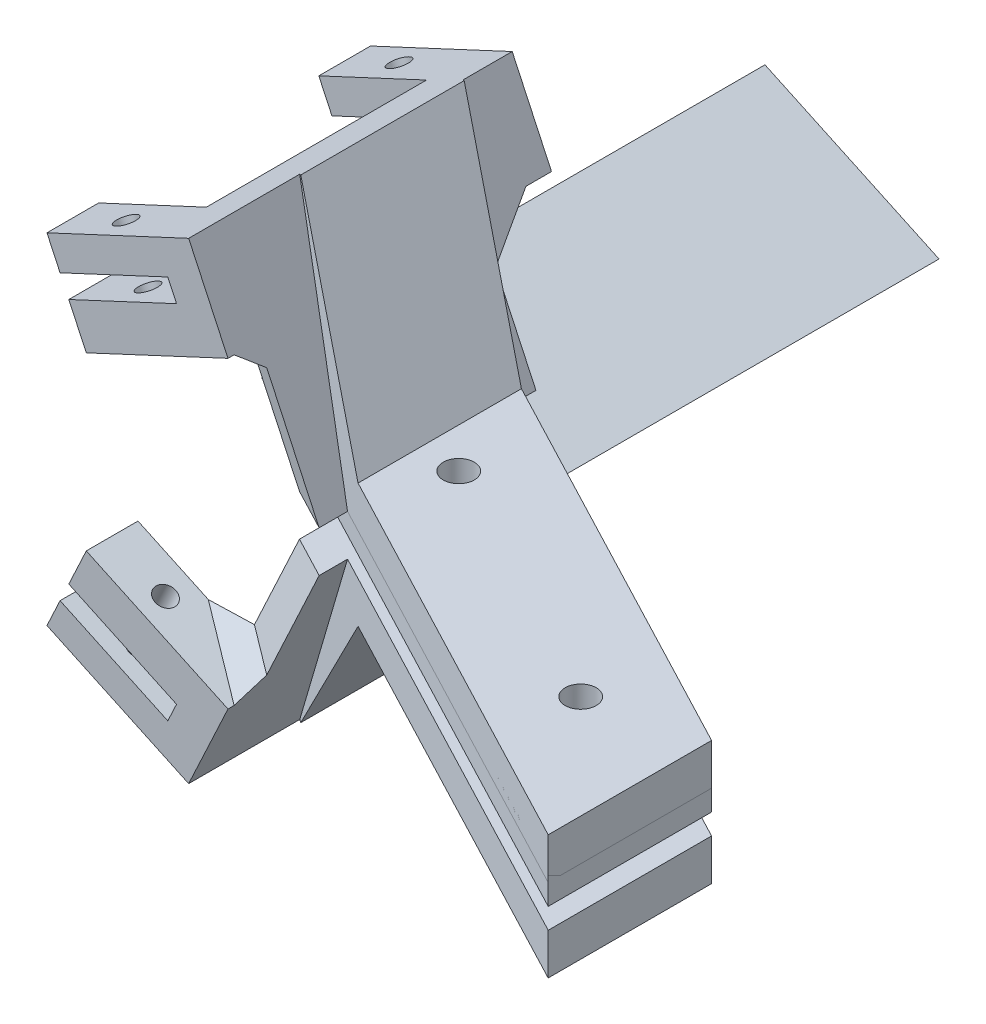
from build123d import *

# Parameters (mm, degrees)
BOSS_EXTRUDE1_DEPTH             = 3
SKETCH1_R                       = 6
BOSS_EXTRUDE3_DEPTH             = 2
SKETCH4_R                       = 1.5
CUT_EXTRUDE1_DEPTH              = 44.812962497
SKETCH5_R                       = 3.25
CUT_EXTRUDE2_DEPTH              = 2
SKETCH6_R                       = 1.5
BOSS_EXTRUDE4_DEPTH             = 4
CUT_EXTRUDE3_DEPTH              = 48.222467532
CUT_EXTRUDE3_DEPTH_BACK         = 48.222467532
SKETCH9_W                       = 15.125231148
SKETCH9_H                       = 5
SKETCH9_R                       = 1
BOSS_EXTRUDE6_DEPTH             = 4
SKETCH10_W                      = 3.625231148
SKETCH10_H                      = 31.3
BOSS_EXTRUDE7_DEPTH             = 2
SKETCH11_R                      = 1
BOSS_EXTRUDE8_DEPTH             = 3
CHAMFER2_SIZE                   = 4
CHAMFER3_SIZE                   = 2
CHAMFER4_SIZE                   = 4
CHAMFER4_SIZE_2                 = 20
BOSS_EXTRUDE9_DEPTH             = 47
BOSS_EXTRUDE9_DIRECTION_2_REACH = 51.204
SKETCH19_R                      = 3.25
CUT_EXTRUDE4_DEPTH              = 64.192904103
SKETCH20_R                      = 1.5
CUT_EXTRUDE5_DEPTH              = 64.192904103


with BuildPart() as part:
    # Sketch3 → Boss-Extrude1 (new body)
    with BuildSketch(Plane(origin=(0, 0, 0), x_dir=(1, 0, 0), z_dir=(0, 1, 0))):
        Polygon((-10, 13.145588768), (-10, -2.661376867), (34.799193535, -26.145588768), (34.799193535, -10.338623133), align=None)
    extrude(amount=BOSS_EXTRUDE1_DEPTH)

    # Sketch1 → Boss-Extrude3 (add)
    with BuildSketch(Plane(origin=(0, 0, 0), x_dir=(1, 0, 0), z_dir=(0, 1, 0))):
        with Locations(Location((0, 0, 0), (0, 0, 270))):
            Circle(SKETCH1_R)
        with Locations(Location((24.799193535, -13, 0), (0, 0, 270))):
            Circle(SKETCH1_R)
    extrude(amount=-BOSS_EXTRUDE3_DEPTH)

    # Sketch4 → Cut-Extrude1 (cut, through all)
    with BuildSketch(Plane(origin=(0, 3, 0), x_dir=(1, 0, 0), z_dir=(0, 1, 0))):
        with Locations(Location((0, 0, 0), (0, 0, 270))):
            Circle(SKETCH4_R)
        with Locations(Location((24.799193535, -13, 0), (0, 0, 270))):
            Circle(SKETCH4_R)
    extrude(amount=-CUT_EXTRUDE1_DEPTH, mode=Mode.SUBTRACT)

    # Sketch5 → Cut-Extrude2 (cut)
    with BuildSketch(Plane(origin=(0, 3, 0), x_dir=(1, 0, 0), z_dir=(0, 1, 0))):
        with Locations(Location((0, 0, 0), (0, 0, 270))):
            Circle(SKETCH5_R)
        with Locations(Location((24.799193535, -13, 0), (0, 0, 270))):
            Circle(SKETCH5_R)
    extrude(amount=-CUT_EXTRUDE2_DEPTH, mode=Mode.SUBTRACT)

    # Sketch18 → Boss-Extrude9 (add)
    with BuildSketch(Plane.XY):
        Polygon((-10, 0), (-19.06307787, 4.226182617), (-17.372604823, 7.851413766), (-0.535193667, 0), align=None)
    extrude(amount=-BOSS_EXTRUDE9_DEPTH)

    # Boss-Extrude9 direction 2: up to this face of the body (flat: up to its plane)
    boss_extrude9_direction_2_end = Plane(part.part.faces().sort_by_distance((12.399596768, 1.5, 14.403482818))[0])
    # Sketch18 → Boss-Extrude9 direction 2 (add, up to the picked face)
    with BuildSketch(Plane.XY, mode=Mode.PRIVATE) as boss_extrude9_direction_2_sk1:
        Polygon((-10, 0), (-19.06307787, 4.226182617), (-17.372604823, 7.851413766), (-0.535193667, 0), align=None)
    boss_extrude9_direction_2_tool1 = split(extrude(boss_extrude9_direction_2_sk1.sketch, amount=BOSS_EXTRUDE9_DIRECTION_2_REACH, mode=Mode.PRIVATE), bisect_by=boss_extrude9_direction_2_end, keep=Keep.BOTH, mode=Mode.PRIVATE)
    add(boss_extrude9_direction_2_tool1.solids().sort_by(Axis((-11.463687, 3.110079, 0), (0, 0, 1)))[0])

    # Sketch19 → Cut-Extrude4 (cut, through all)
    with BuildSketch(Plane(origin=(0, 1, 0), x_dir=(1, 0, 0), z_dir=(0, 1, 0))):
        with Locations(Location((0, 0, 0), (0, 0, 270))):
            Circle(SKETCH19_R)
    extrude(amount=CUT_EXTRUDE4_DEPTH, mode=Mode.SUBTRACT)

    # Sketch20 → Cut-Extrude5 (cut, through all)
    with BuildSketch(Plane(origin=(0, 1, 0), x_dir=(1, 0, 0), z_dir=(0, 1, 0))):
        with Locations(Location((0, 0, 0), (0, 0, 90))):
            Circle(SKETCH20_R)
    extrude(amount=-CUT_EXTRUDE5_DEPTH, mode=Mode.SUBTRACT)


with BuildPart() as body_2:
    # Sketch6 → Boss-Extrude4 (new body)
    with BuildSketch(Plane.XZ.offset(2)):
        Polygon((-10, 2.661376867), (-10, -13.145588768), (34.799193535, 10.338623133), (34.799193535, 26.145588768), align=None)
        with Locations(Location((0, 0, 0), (0, 0, 270))):
            Circle(SKETCH6_R, mode=Mode.SUBTRACT)
        with Locations(Location((24.799193535, 13, 0), (0, 0, 270))):
            Circle(SKETCH6_R, mode=Mode.SUBTRACT)
    extrude(amount=BOSS_EXTRUDE4_DEPTH)

    # Sketch16 → Loft1 section 0
    with BuildSketch(Plane(origin=(0, -18.313540167, 0), x_dir=(-1, 0, 0), z_dir=(0, -1, 0))):
        with BuildLine():
            Line((13.607128711, -7.50473643), (13.607128711, 13.79526357))
            Line((13.607128711, 13.79526357), (17.607128711, 15.892105951))
            Line((17.607128711, 15.892105951), (17.607128711, -5.407894049))
            Line((17.607128711, -5.407894049), (13.607128711, -7.50473643))
        make_face()
    # Sketch7 → Loft1 section 1
    with BuildSketch(Plane(origin=(0, -2, 0), x_dir=(1, 0, 0), z_dir=(0, 1, 0))):
        with BuildLine():
            Line((-10, 15.892105951), (-10, -5.407894049))
            Line((-10, -5.407894049), (-6, -7.50473643))
            Line((-6, -7.50473643), (-6, 13.79526357))
            Line((-6, 13.79526357), (-10, 15.892105951))
        make_face()
    loft()

    # Sketch17 → Cut-Extrude3 (cut, two sides: drawn at the far end of the back side and taken through both)
    with BuildSketch(Plane.XY.offset(-CUT_EXTRUDE3_DEPTH_BACK)):
        Polygon((-17.607128711, -18.313540167), (-13.607128711, -18.313540167), (-16.892703931, -16.78145128), align=None)
    extrude(amount=CUT_EXTRUDE3_DEPTH + CUT_EXTRUDE3_DEPTH_BACK, mode=Mode.SUBTRACT)

    # Sketch9 → Boss-Extrude6 (add)
    # profile 1 of 2: a face of its own
    with BuildSketch(Plane(origin=(-26.705419865, -12.205706693, 0), x_dir=(-0.9063077870366525, 0.42261826174069417, 0), z_dir=(0.4226182617406941, 0.9063077870366524, 0))):
        with Locations((-6.889749661, 7.907894049)):
            Rectangle(SKETCH9_W, SKETCH9_H)
        with Locations(Location((-5.077134087, 7.957894049, 0), (0, 0, 180))):
            Circle(SKETCH9_R, mode=Mode.SUBTRACT)
    # profile 2 of 2: a face of its own
    with BuildSketch(Plane(origin=(-26.705419865, -12.205706693, 0), x_dir=(-0.9063077870366525, 0.42261826174069417, 0), z_dir=(0.4226182617406941, 0.9063077870366524, 0))):
        Polygon((-10.827134087, -15.892105951), (0.672865913, -15.892105951), (0.672865913, -20.892105951), (-14.452365235, -20.892105951), (-14.452365235, -15.892105951), (-14.452365235, -13.79526357), align=None)
        with Locations(Location((-5.077134087, -18.442105951, 0), (0, 0, 180))):
            Circle(SKETCH9_R, mode=Mode.SUBTRACT)
    extrude(amount=BOSS_EXTRUDE6_DEPTH)

    # Sketch10 → Boss-Extrude7 (add)
    with BuildSketch(Plane(origin=(-50.114461272, -1.289891415, 0), x_dir=(-0.9063077870366525, 0.42261826174069417, 0), z_dir=(0.4226182617406941, 0.9063077870366524, 0))):
        with Locations((-38.468769054, -5.242105951)):
            Rectangle(SKETCH10_W, SKETCH10_H)
    extrude(amount=-BOSS_EXTRUDE7_DEPTH)

    # Sketch11 → Boss-Extrude8 (add)
    with BuildSketch(Plane(origin=(-10.290046849, -22.06707668, 0), x_dir=(0.9063077870366528, -0.4226182617406936, 0), z_dir=(-0.4226182617406936, -0.9063077870366528, 0))):
        Polygon((-19.717841347, 10.407894049), (-4.592610199, 10.407894049), (-4.592610199, -20.892105951), (-19.717841347, -20.892105951), (-19.717841347, -15.892105951), (-8.217841347, -15.892105951), (-8.217841347, 5.407894049), (-19.717841347, 5.407894049), align=None)
        with Locations((-13.967841347, -18.442105951)):
            Circle(SKETCH11_R, mode=Mode.SUBTRACT)
        with Locations((-13.967841347, 7.957894049)):
            Circle(SKETCH11_R, mode=Mode.SUBTRACT)
    extrude(amount=BOSS_EXTRUDE8_DEPTH)

    # Chamfer2
    # the kernel refuses this chamfer: 4 mm, written as the material it adds along each edge
    with BuildSketch(Plane(origin=(-3.8464274, -18.451518261, -8.644872691), x_dir=(0.4419809959760686, -0.23643746629724946, -0.8653034864872206), z_dir=(-0.7845279046867107, 0.36583136999170246, -0.5006829091329899))) as chamfer2_piece_1_section:
        Polygon((CHAMFER2_SIZE * 0.999621916911, -CHAMFER2_SIZE * 0.0274958766106), (-CHAMFER2_SIZE * 0.0274958766106, -CHAMFER2_SIZE * 0.999621916911), (0, 0), align=None)
    chamfer2_piece_1 = extrude(amount=24.761428665, mode=Mode.PRIVATE)
    chamfer2_piece_1 = split(chamfer2_piece_1, bisect_by=Plane(origin=(-11.168720037, -13.084355891, -15.118782346), z_dir=(-0.9063077870366527, 0.4226182617406936, 0)), keep=Keep.TOP, mode=Mode.PRIVATE)
    chamfer2_piece_1 = split(chamfer2_piece_1, bisect_by=Plane(origin=(-14.454295257, -11.552267004, -15.118782346), z_dir=(0.9063077870366528, -0.4226182617406935, 0)), keep=Keep.TOP, mode=Mode.PRIVATE)
    add(chamfer2_piece_1)

    # Chamfer3
    # the kernel refuses this chamfer: 2 mm, written as the material it adds along each edge
    with BuildSketch(Plane(origin=(-7.881541532, -16.56991364, 10.079931869), x_dir=(0.43493535837395614, 0.900147062018719, -0.023801276755393234), z_dir=(-0.7845279046867109, 0.36583136999170235, -0.5006829091329895))) as chamfer3_piece_1_section:
        Polygon((CHAMFER3_SIZE * 0.999621916911, -CHAMFER3_SIZE * 0.0274958766106), (-CHAMFER3_SIZE * 0.0274958766106, -CHAMFER3_SIZE * 0.999621916911), (0, 0), align=None)
    chamfer3_piece_1 = extrude(amount=14.474696714, mode=Mode.PRIVATE)
    chamfer3_piece_1 = split(chamfer3_piece_1, bisect_by=Plane(origin=(-11.638128642, -14.091005892, 7.219593403), z_dir=(-0.9063077870365974, 0.42261826174081224, 0)), keep=Keep.TOP, mode=Mode.PRIVATE)
    chamfer3_piece_1 = split(chamfer3_piece_1, bisect_by=Plane(origin=(-14.923703861, -12.558917005, 7.219593403), z_dir=(0.9063077870365974, -0.42261826174081224, 0)), keep=Keep.TOP, mode=Mode.PRIVATE)
    chamfer3_piece_1 = split(chamfer3_piece_1, bisect_by=Plane(origin=(-13.279775159, -13.325493549, 5.407894049), z_dir=(0, 0, 1)), keep=Keep.TOP, mode=Mode.PRIVATE)
    add(chamfer3_piece_1)
    with BuildSketch(Plane(origin=(-7.881541532, -16.56991364, 10.079931869), x_dir=(0.43493535837395614, 0.900147062018719, -0.023801276755393234), z_dir=(-0.7845279046867109, 0.36583136999170235, -0.5006829091329895))) as chamfer3_piece_2_section:
        Polygon((CHAMFER3_SIZE * 0.999621916911, -CHAMFER3_SIZE * 0.0274958766106), (-CHAMFER3_SIZE * 0.0274958766106, -CHAMFER3_SIZE * 0.999621916911), (0, 0), align=None)
    chamfer3_piece_2 = extrude(amount=14.474696714, mode=Mode.PRIVATE)
    chamfer3_piece_2 = split(chamfer3_piece_2, bisect_by=Plane(origin=(-15.009693587, -12.743322567, 6.010096265), z_dir=(-0.9063077870365974, 0.42261826174081224, 0)), keep=Keep.TOP, mode=Mode.PRIVATE)
    chamfer3_piece_2 = split(chamfer3_piece_2, bisect_by=Plane(origin=(-15.953293685, -12.303314615, 5.407894049), z_dir=(0, 0, 1)), keep=Keep.TOP, mode=Mode.PRIVATE)
    add(chamfer3_piece_2)

    # Chamfer4
    # the kernel refuses this chamfer: 20, 4 mm, written as the material it adds along each edge
    with BuildSketch(Plane(origin=(-7.865230633, -6, -64.000203695), x_dir=(0.9892134397382245, 0.14648129792321618, 0), z_dir=(0, 0, 1))) as chamfer4_piece_1_section:
        Polygon((CHAMFER4_SIZE * 0.989213439738, -CHAMFER4_SIZE * 0.146481297923), (-CHAMFER4_SIZE_2 * 0.550816805356, -CHAMFER4_SIZE_2 * 0.83462617197), (0, 0), align=None)
    chamfer4_piece_1 = extrude(amount=119.75433293, mode=Mode.PRIVATE)
    chamfer4_piece_1 = split(chamfer4_piece_1, bisect_by=Plane(origin=(-17.061497647, -14.46567413, -1.040335016), z_dir=(0.4642857142857141, 0, -0.8856854834026604)), keep=Keep.TOP, mode=Mode.PRIVATE)
    chamfer4_piece_1 = split(chamfer4_piece_1, bisect_by=Plane(origin=(-10.561497647, -14.46567413, -13.439931784), z_dir=(-0.4642857142857143, 0, 0.8856854834026603)), keep=Keep.TOP, mode=Mode.PRIVATE)
    chamfer4_piece_1 = split(chamfer4_piece_1, bisect_by=Plane(origin=(-14.743147871, -23.300695327, -13.322016998), z_dir=(0.4226182617406936, 0.9063077870366527, 0)), keep=Keep.TOP, mode=Mode.PRIVATE)
    add(chamfer4_piece_1)


with BuildPart() as body_3:
    # Mirror1: mirrored copy
    add(body_2.part.mirror(Plane.ZX))


solid = Compound([part.part, body_2.part, body_3.part])
